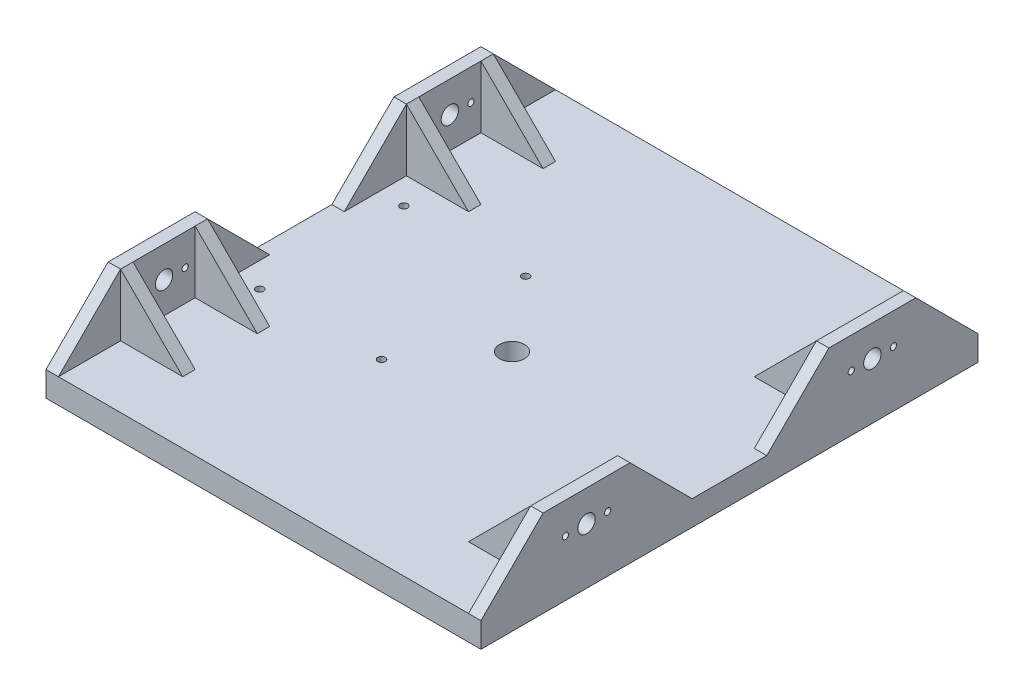
from build123d import *

# Parameters (mm, degrees)
SKETCH1_W                = 175
SKETCH1_H                = 200
BOSS_EXTRUDE1_DEPTH      = 10
SKETCH3_W                = 5
SKETCH3_H                = 25
SKETCH3_W_2              = 25
SKETCH3_H_2              = 5
BOSS_EXTRUDE2_DEPTH      = 25
CHAMFER1_SIZE            = 25
SKETCH4_R                = 3.5
SKETCH4_R_2              = 1.25
CUT_EXTRUDE1_DEPTH       = 25
CHAMFER1_OF_MIRROR1_SIZE = 25
SKETCH5_R                = 5
CUT_EXTRUDE2_DEPTH       = 10
SKETCH6_R                = 1.5
CUT_EXTRUDE3_DEPTH       = 10


# Read off the part's stored shape, not the designer's step: Mirror2
with BuildPart() as part:
    # Sketch1 → Boss-Extrude1 (new body)
    with BuildSketch(Plane(origin=(0, 0, 0), x_dir=(1, 0, 0), z_dir=(0, 1, 0))):
        with Locations((87.5, 100)):
            Rectangle(SKETCH1_W, SKETCH1_H)
    extrude(amount=BOSS_EXTRUDE1_DEPTH)

    # Sketch3 → Boss-Extrude2 (add)
    with BuildSketch(Plane(origin=(0, 10, 0), x_dir=(1, 0, 0), z_dir=(0, 1, 0))):
        with Locations((2.5, 72.5)):
            Rectangle(SKETCH3_W, SKETCH3_H)
        Polygon((0, 60), (0, 25), (5, 25), (5, 30), (5, 55), (5, 60), align=None)
        with Locations((17.5, 57.5)):
            Rectangle(SKETCH3_W_2, SKETCH3_H_2)
        with Locations((17.5, 27.5)):
            Rectangle(SKETCH3_W_2, SKETCH3_H_2)
        with Locations((2.5, 12.5)):
            Rectangle(SKETCH3_W, SKETCH3_H)
    boss_extrude2 = extrude(amount=BOSS_EXTRUDE2_DEPTH)

    # Chamfer1
    chamfer1_edges = [part.edges().sort_by_distance(p)[0] for p in [
        (2.5, 35, -85),
        (30, 35, -57.5),
        (30, 35, -27.5),
        (2.5, 35, 0),
    ]]
    chamfer(chamfer1_edges, length=CHAMFER1_SIZE - 0.0001)  # a hair under: the kernel refuses the full size

    # Sketch4 → Cut-Extrude1 (cut)
    with BuildSketch(Plane(origin=(5, 0, 0), x_dir=(0, 0, -1), z_dir=(1, 0, 0))):
        with Locations((42.5, 22.5)):
            Circle(SKETCH4_R)
        with Locations((34, 22.5)):
            Circle(SKETCH4_R_2)
        with Locations((51, 22.5)):
            Circle(SKETCH4_R_2)
    cut_extrude1 = extrude(amount=-CUT_EXTRUDE1_DEPTH, mode=Mode.SUBTRACT)

    # Mirror1: Boss-Extrude2, Cut-Extrude1 across plane
    add(boss_extrude2.mirror(Plane(origin=(87.5, 0, 0), x_dir=(0, 0, 1), z_dir=(1, 0, 0))))
    add(cut_extrude1.mirror(Plane(origin=(87.5, 0, 0), x_dir=(0, 0, 1), z_dir=(1, 0, 0))), mode=Mode.SUBTRACT)

    # Chamfer1 of Mirror1
    chamfer1_of_mirror1_edges = [part.edges().sort_by_distance(p)[0] for p in [
        (172.5, 35, -85),
        (145, 35, -57.5),
        (145, 35, -27.5),
        (172.5, 35, 0),
    ]]
    chamfer(chamfer1_of_mirror1_edges, length=CHAMFER1_OF_MIRROR1_SIZE - 0.0001)  # a hair under: the kernel refuses the full size

    # Mirror2: part across plane


with BuildPart() as part_1:
    add(part.part)
    add(part.part.mirror(Plane.XY.offset(-100)))

    # Sketch5 → Cut-Extrude2 (cut)
    with BuildSketch(Plane(origin=(0, 10, 0), x_dir=(1, 0, 0), z_dir=(0, 1, 0))):
        with Locations(Location((87.5, 100, 0), (0, 0, 270))):
            Circle(SKETCH5_R)
    extrude(amount=-CUT_EXTRUDE2_DEPTH, mode=Mode.SUBTRACT)

    # Sketch6 → Cut-Extrude3 (cut)
    with BuildSketch(Plane.XZ):
        with Locations(Location((15, -71, 0), (0, 0, 270))):
            Circle(SKETCH6_R)
        with Locations(Location((64, -71, 0), (0, 0, 270))):
            Circle(SKETCH6_R)
        with Locations(Location((15, -129, 0), (0, 0, 270))):
            Circle(SKETCH6_R)
        with Locations(Location((64, -129, 0), (0, 0, 270))):
            Circle(SKETCH6_R)
    extrude(amount=-CUT_EXTRUDE3_DEPTH, mode=Mode.SUBTRACT)


solid = part_1.part
